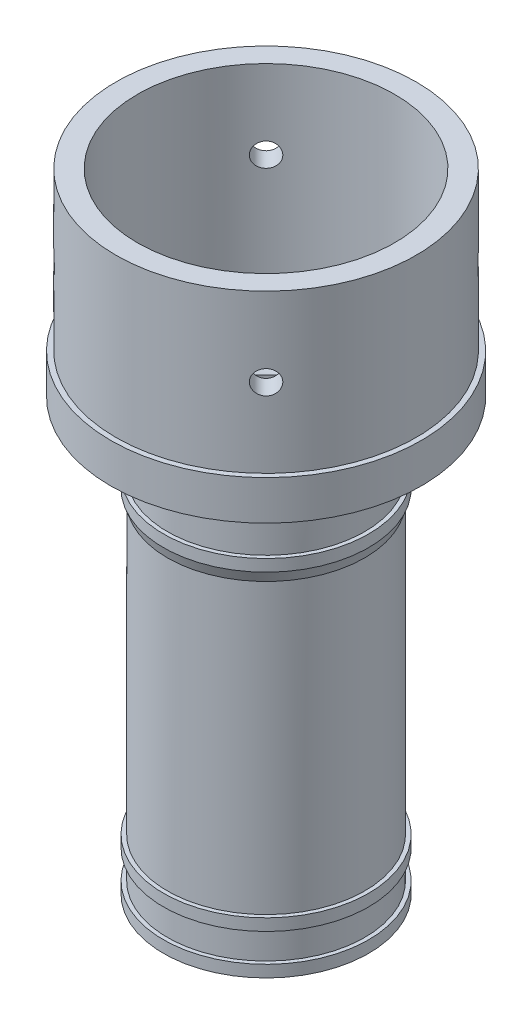
from build123d import *

# Parameters (mm, degrees)
SKETCH2_R                 = 25
SKETCH2_R_2               = 20.85
BOSS_EXTRUDE1_DEPTH       = 99.25
BOSS_EXTRUDE2_START       = 10
SKETCH3_R                 = 38.05
SKETCH3_R_2               = 32.6
BOSS_EXTRUDE2_DEPTH       = 50
BOSS_EXTRUDE3_START       = -50
BOSS_EXTRUDE3_OUTLINE_R   = 39.35
BOSS_EXTRUDE3_OUTLINE_R_2 = 38.05
BOSS_EXTRUDE3_DEPTH       = 10
CUT_EXTRUDE1_REACH        = 186.77
CUT_EXTRUDE1_END_RADIUS   = 32.6
SKETCH7_R                 = 3
CIRPATTERN1_COUNT         = 4
SKETCH8_R                 = 26
SKETCH8_R_2               = 25
BOSS_EXTRUDE5_DEPTH       = 3
BOSS_EXTRUDE6_START       = -92.05
BOSS_EXTRUDE6_OUTLINE_R   = 26
BOSS_EXTRUDE6_OUTLINE_R_2 = 25
BOSS_EXTRUDE6_DEPTH       = 6
CHAMFER1_SIZE             = 1.091910703
CHAMFER1_SIZE_2           = 3
BOSS_EXTRUDE7_START       = -10.2
SKETCH10_R                = 26
SKETCH10_R_2              = 25
BOSS_EXTRUDE7_DEPTH       = 3


with BuildPart() as part:
    # Sketch2 → Boss-Extrude1 (new body)
    with BuildSketch(Plane(origin=(0, 0, 0), x_dir=(1, 0, 0), z_dir=(0, 1, 0))):
        with Locations(Location((0, 0, 0), (0, 0, 270))):
            Circle(SKETCH2_R)
        with Locations(Location((0, 0, 0), (0, 0, 270))):
            Circle(SKETCH2_R_2, mode=Mode.SUBTRACT)
    extrude(amount=BOSS_EXTRUDE1_DEPTH)



with BuildPart() as body_2:
    # Sketch3 → Boss-Extrude2 (new body)
    with BuildSketch(Plane(origin=(0, 99.25, 0), x_dir=(1, 0, 0), z_dir=(0, 1, 0)).offset(BOSS_EXTRUDE2_START)):
        with Locations(Location((0, 0, 0), (0, 0, 270))):
            Circle(SKETCH3_R)
        with Locations(Location((0, 0, 0), (0, 0, 270))):
            Circle(SKETCH3_R_2, mode=Mode.SUBTRACT)
    extrude(amount=BOSS_EXTRUDE2_DEPTH)


with BuildPart() as part_1:
    add(part.part)

    add(body_2.part)  # loft3 joins it to this body
    # loft up to a face of the part (loft3)
    loft([Face(Wire([part_1.edges().sort_by_distance((18.224215686, 99.25, -17.113677648))[0]])), Face(Wire([part_1.edges().sort_by_distance((-27.737256273, 109.25, -26.047017381))[0]]))])

    # Cut-Loft1: read off the stored shape, not the designer's step
    # Cut-Loft1: loft between two sections, ruled curve by curve
    cut_loft1_from = [
        Edge.make_bspline([(-19.857674291, 99.25, 6.355727475), (-7.146219341, 99.25, 46.071076058), (32.569129241, 99.25, 33.359621108), (19.857674291, 99.25, -6.355727475), (7.146219341, 99.25, -46.071076058), (-32.569129241, 99.25, -33.359621108), (-19.857674291, 99.25, 6.355727475)], [0, 0, 0, 0, 0.5, 0.5, 0.5, 1, 1, 1, 1], 3, [1, 0.333333333, 0.333333333, 1, 0.333333333, 0.333333333, 1]),
    ]
    cut_loft1_to = [
        Edge.make_bspline([(-21.296342667, 109.25, 24.682499651), (28.068656636, 109.25, 67.275184984), (70.661341969, 109.25, 17.910185682), (21.296342667, 109.25, -24.682499651), (-28.068656636, 109.25, -67.275184984), (-70.661341969, 109.25, -17.910185682), (-21.296342667, 109.25, 24.682499651)], [0, 0, 0, 0, 0.5, 0.5, 0.5, 1, 1, 1, 1], 3, [1, 0.333333333, 0.333333333, 1, 0.333333333, 0.333333333, 1]),
    ]
    cut_loft1 = Solid(Shell([*[Face.make_surface_from_curves(cut_loft1_from[k], cut_loft1_to[k]) for k in range(1)], Face(Wire(cut_loft1_from)), Face(Wire(cut_loft1_to))]))
    add(cut_loft1, mode=Mode.SUBTRACT)

    # Boss-Extrude3: read off the stored shape, not the designer's step
    # Boss-Extrude3 outline → Boss-Extrude3 (add)
    with BuildSketch(Plane(origin=(0, 159.25, 0), x_dir=(1, 0, 0), z_dir=(0, 1, 0)).offset(BOSS_EXTRUDE3_START)):
        Circle(BOSS_EXTRUDE3_OUTLINE_R)
        Circle(BOSS_EXTRUDE3_OUTLINE_R_2, mode=Mode.SUBTRACT)
    extrude(amount=BOSS_EXTRUDE3_DEPTH)

    # Cut-Extrude1: up to this cylinder (the profile starts outside it)
    cut_extrude1_end = Plane(origin=(0, 139.25, 0), z_dir=(0, -1, 0)) * Cylinder(CUT_EXTRUDE1_END_RADIUS, 439.74, mode=Mode.PRIVATE)
    # Sketch7 → Cut-Extrude1 (cut, up to the surface)
    with BuildSketch(Plane(origin=(-26.905413024, 0, 26.905413024), x_dir=(0, -1, 0), z_dir=(-0.7071067811865488, 0, 0.7071067811865464)), mode=Mode.PRIVATE) as cut_extrude1_sk1:
        with Locations(Location((-139.25, 0, 0), (0, 0, 90))):
            Circle(SKETCH7_R)
    cut_extrude1_tool1 = extrude(cut_extrude1_sk1.sketch, amount=-CUT_EXTRUDE1_REACH, mode=Mode.PRIVATE) - cut_extrude1_end
    cut_extrude1 = cut_extrude1_tool1.solids().sort_by_distance((-26.905413, 139.25, 26.905413))[0]
    add(cut_extrude1, mode=Mode.SUBTRACT)

    # CirPattern1: Cut-Extrude1 ×4 about axis
    cirpattern1_axis = Axis((0, 159.25, 0), (0, -1, 0))
    for i in range(1, CIRPATTERN1_COUNT):
        add(cut_extrude1.rotate(cirpattern1_axis, i * 360 / CIRPATTERN1_COUNT), mode=Mode.SUBTRACT)

    # Sketch8 → Boss-Extrude5 (add)
    with BuildSketch(Plane.XZ):
        with Locations(Location((0, 0, 0), (0, 0, 270))):
            Circle(SKETCH8_R)
        with Locations(Location((0, 0, 0), (0, 0, 270))):
            Circle(SKETCH8_R_2, mode=Mode.SUBTRACT)
    extrude(amount=-BOSS_EXTRUDE5_DEPTH)

    # Boss-Extrude6: read off the stored shape, not the designer's step
    # Boss-Extrude6 outline → Boss-Extrude6 (add)
    with BuildSketch(Plane.XZ.offset(BOSS_EXTRUDE6_START)):
        Circle(BOSS_EXTRUDE6_OUTLINE_R)
        Circle(BOSS_EXTRUDE6_OUTLINE_R_2, mode=Mode.SUBTRACT)
    extrude(amount=BOSS_EXTRUDE6_DEPTH)

    # Chamfer1
    # the kernel refuses this chamfer: 3, 1.091910703 mm, written as the material it takes off along each edge
    with BuildSketch(Plane(origin=(0, 86.05, 0), x_dir=(1, 0, 0), z_dir=(0, 0, -1))) as chamfer1_piece_1_section:
        Polygon((26 - CHAMFER1_SIZE, 0), (26, -CHAMFER1_SIZE_2), (26, 0), align=None)
    chamfer1_piece_1 = revolve(axis=Axis((0, 86.05, 0), (0, -1, 0)), mode=Mode.PRIVATE)
    chamfer1_piece_1 = chamfer1_piece_1 - Plane(origin=(0, 86.05, 0), x_dir=(0, 0, 1), z_dir=(0, -1, 0)) * Cylinder(25, 104, mode=Mode.PRIVATE)
    add(chamfer1_piece_1, mode=Mode.SUBTRACT)

    # Sketch10 → Boss-Extrude7 (add)
    with BuildSketch(Plane.XZ.offset(BOSS_EXTRUDE7_START)):
        with Locations(Location((0, 0, 0), (0, 0, 270))):
            Circle(SKETCH10_R)
        with Locations(Location((0, 0, 0), (0, 0, 270))):
            Circle(SKETCH10_R_2, mode=Mode.SUBTRACT)
    extrude(amount=-BOSS_EXTRUDE7_DEPTH)


solid = part_1.part
